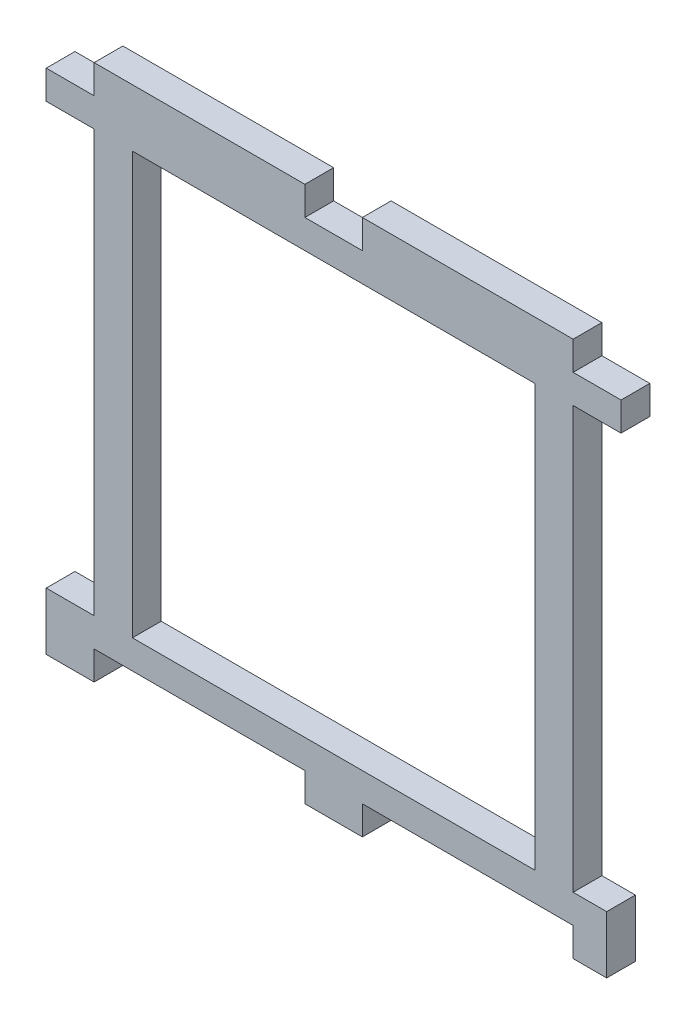
from build123d import *

# Parameters (mm, degrees)
SKETCH1_W           = 42
SKETCH1_H           = 44
BOSS_EXTRUDE1_DEPTH = 3


with BuildPart() as part:
    # Sketch1 → Boss-Extrude1 (new body)
    with BuildSketch(Plane.XY):
        Polygon((0, 0), (5, 0), (5, 3), (27, 3), (27, 0), (33, 0), (33, 3), (55, 3), (55, 0), (60, 0), (60, -3), (55, -3), (55, -47), (58.5, -47), (58.5, -53), (55, -53), (55, -50), (33, -50), (33, -53), (27, -53), (27, -50), (5, -50), (5, -53), (0, -53), (0, -47), (5, -47), (5, -3), (0, -3), align=None)
        with Locations((30, -25)):
            Rectangle(SKETCH1_W, SKETCH1_H, mode=Mode.SUBTRACT)
    extrude(amount=BOSS_EXTRUDE1_DEPTH)


solid = part.part
